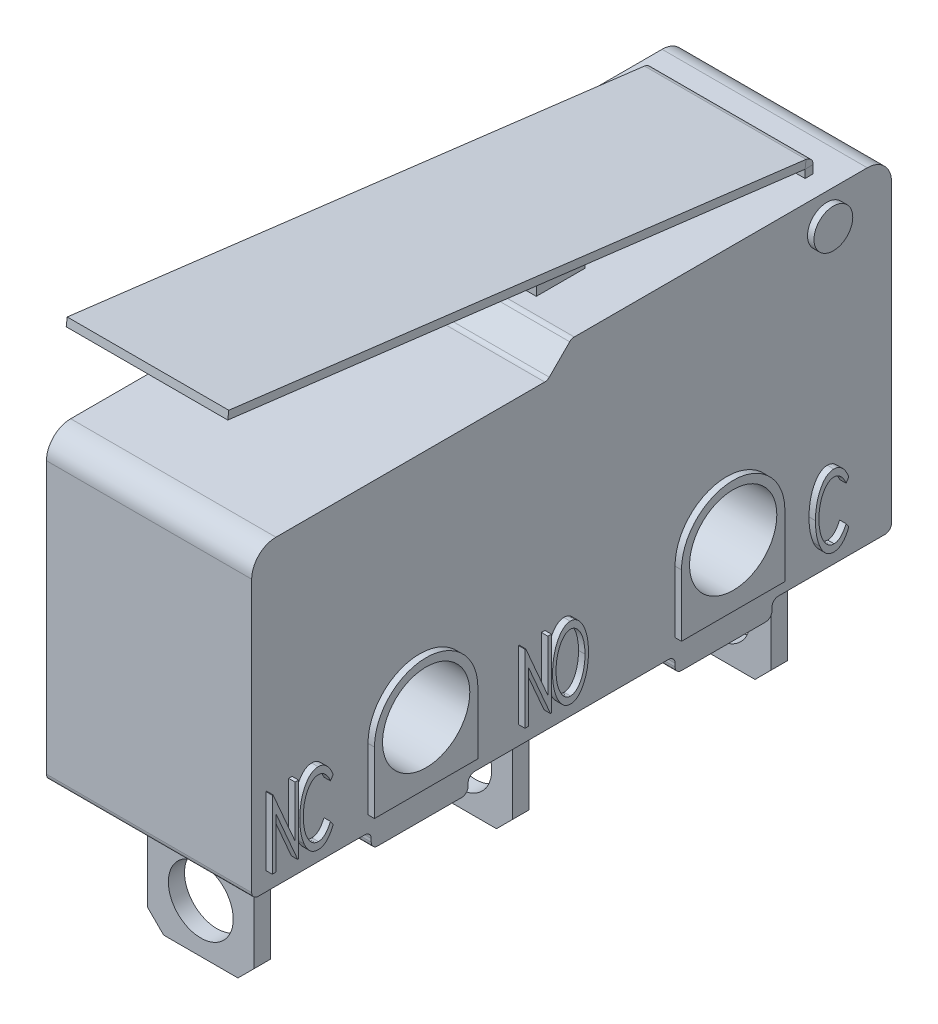
from build123d import *

# Parameters (mm, degrees)
BOSS_EXTRUDE1_DEPTH        = 3.175
SKETCH2_R                  = 1.35
CUT_EXTRUDE1_DEPTH         = 14.60340031
SKETCH4_W                  = 3
SKETCH4_H                  = 1.5
BOSS_EXTRUDE2_DEPTH        = 1
FILLET1_R                  = 0.25
SKETCH3_R                  = 0.6
BOSS_EXTRUDE3_DEPTH        = 0.2
BOSS_EXTRUDE4_START        = 0.2
SKETCH7_R                  = 1.35
BOSS_EXTRUDE4_DEPTH        = 0.2
BASE_FLANGE1_DEPTH         = 5
SKETCH13_W                 = 3.3
SKETCH13_H                 = 0.5
BOSS_EXTRUDE5_DEPTH        = 3.9
CHAMFER1_SIZE              = 0.5
SKETCH14_R                 = 1.003757991
CUT_EXTRUDE3_DEPTH         = 1
LPATTERN1_COUNT            = 3
LPATTERN1_PITCH            = 8
CHAMFER1_OF_LPATTERN1_SIZE = 0.5
BOSS_EXTRUDE6_DEPTH        = 0.2


# Sheet-metal steps are written as plain solids
with BuildPart() as part:
    # Sketch1 → Boss-Extrude1 (new, symmetric)
    with BuildSketch(Plane(origin=(0, 0, 0), x_dir=(0, 0, -1), z_dir=(1, 0, 0))):
        with BuildLine():
            Line((8.8, -4.8), (5.5, -4.8))
            ThreePointArc((5.5, -4.8), (5.358578644, -4.858578644), (5.3, -5))
            Line((5.3, -5), (5.3, -5.1))
            ThreePointArc((5.3, -5.1), (5.241421356, -5.241421356), (5.1, -5.3))
            Line((5.1, -5.3), (2.5, -5.3))
            ThreePointArc((2.5, -5.3), (2.358578644, -5.241421356), (2.3, -5.1))
            Line((2.3, -5.1), (2.3, -5))
            ThreePointArc((2.3, -5), (2.241421356, -4.858578644), (2.1, -4.8))
            Line((2.1, -4.8), (-3.9, -4.8))
            ThreePointArc((-3.9, -4.8), (-4.041421356, -4.858578644), (-4.1, -5))
            Line((-4.1, -5), (-4.1, -5.1))
            ThreePointArc((-4.1, -5.1), (-4.158578644, -5.241421356), (-4.3, -5.3))
            Line((-4.3, -5.3), (-6.9, -5.3))
            ThreePointArc((-6.9, -5.3), (-7.041421356, -5.241421356), (-7.1, -5.1))
            Line((-7.1, -5.1), (-7.1, -5))
            ThreePointArc((-7.1, -5), (-7.158578644, -4.858578644), (-7.3, -4.8))
            Line((-7.3, -4.8), (-10.6, -4.8))
            ThreePointArc((-10.6, -4.8), (-10.741421356, -4.741421356), (-10.8, -4.6))
            Line((-10.8, -4.6), (-10.8, 3.8))
            ThreePointArc((-10.8, 3.8), (-10.580330086, 4.330330086), (-10.05, 4.55))
            Line((-10.05, 4.55), (-1.732842712, 4.55))
            ThreePointArc((-1.732842712, 4.55), (-1.656306026, 4.565224093), (-1.591421356, 4.608578644))
            Line((-1.591421356, 4.608578644), (-0.958578644, 5.241421356))
            ThreePointArc((-0.958578644, 5.241421356), (-0.893693974, 5.284775907), (-0.817157288, 5.3))
            Line((-0.817157288, 5.3), (8.25, 5.3))
            ThreePointArc((8.25, 5.3), (8.780330086, 5.080330086), (9, 4.55))
            Line((9, 4.55), (9, -4.6))
            ThreePointArc((9, -4.6), (8.941421356, -4.741421356), (8.8, -4.8))
        make_face()
    extrude(amount=BOSS_EXTRUDE1_DEPTH, both=True)

    # Sketch2 → Cut-Extrude1 (cut, through all)
    with BuildSketch(Plane(origin=(3.175, 0, 0), x_dir=(0, 0, -1), z_dir=(1, 0, 0))):
        with Locations((-5.6, -2.4)):
            Circle(SKETCH2_R)
        with Locations((3.9, -2.4)):
            Circle(SKETCH2_R)
    extrude(amount=-CUT_EXTRUDE1_DEPTH, mode=Mode.SUBTRACT)

    # Sketch4 → Boss-Extrude2 (add)
    with BuildSketch(Plane(origin=(0, 5.3, 0), x_dir=(1, 0, 0), z_dir=(0, 1, 0))):
        with Locations((0, 0.432842712)):
            Rectangle(SKETCH4_W, SKETCH4_H)
    extrude(amount=BOSS_EXTRUDE2_DEPTH)

    # Fillet1
    fillet1_edges = [part.edges().sort_by_distance(p)[0] for p in [
        (1.5, 6.3, -0.432842712),
        (0, 6.3, -1.182842712),
        (-1.5, 6.3, -0.432842712),
        (0, 6.3, 0.317157288),
    ]]
    fillet(fillet1_edges, radius=FILLET1_R)

    # Sketch3 → Boss-Extrude3 (add)
    with BuildSketch(Plane(origin=(3.175, 0, 0), x_dir=(0, 0, -1), z_dir=(1, 0, 0))):
        with Locations((7, 4.4)):
            Circle(SKETCH3_R)
    boss_extrude3 = extrude(amount=BOSS_EXTRUDE3_DEPTH)

    # Mirror2: Boss-Extrude3 across plane
    add(boss_extrude3.mirror(Plane(origin=(0, 0, 0), x_dir=(0, 0, 1), z_dir=(1, 0, 0))))

    # Sketch7 → Boss-Extrude4 (add)
    # profile 1 of 2: a face of its own
    with BuildSketch(Plane(origin=(3.175, 0, 0), x_dir=(0, 0, -1), z_dir=(1, 0, 0)).offset(BOSS_EXTRUDE4_START)):
        with BuildLine():
            Line((-7.2, -2.4), (-7.2, -4.31448584))
            Line((-7.2, -4.31448584), (-4, -4.31448584))
            Line((-4, -4.31448584), (-4, -2.4))
            ThreePointArc((-4, -2.4), (-5.6, -0.8), (-7.2, -2.4))
        make_face()
        with Locations((-5.6, -2.4)):
            Circle(SKETCH7_R, mode=Mode.SUBTRACT)
    # profile 2 of 2: a face of its own
    with BuildSketch(Plane(origin=(3.175, 0, 0), x_dir=(0, 0, -1), z_dir=(1, 0, 0)).offset(BOSS_EXTRUDE4_START)):
        with BuildLine():
            Line((2.3, -4.31448584), (5.5, -4.31448584))
            Line((5.5, -4.31448584), (5.5, -2.4))
            ThreePointArc((5.5, -2.4), (3.9, -0.8), (2.3, -2.4))
            Line((2.3, -2.4), (2.3, -4.31448584))
        make_face()
        with Locations((3.9, -2.4)):
            Circle(SKETCH7_R, mode=Mode.SUBTRACT)
    extrude(amount=-BOSS_EXTRUDE4_DEPTH)

    # Sketch13 → Boss-Extrude5 (add)
    with BuildSketch(Plane.XZ.offset(4.8)):
        with Locations((0, 8.95)):
            Rectangle(SKETCH13_W, SKETCH13_H)
    boss_extrude5 = extrude(amount=BOSS_EXTRUDE5_DEPTH)

    # Chamfer1
    chamfer1_edges = [part.edges().sort_by_distance(p)[0] for p in [
        (1.65, -8.7, 8.95),
        (-1.65, -8.7, 8.95),
    ]]
    chamfer(chamfer1_edges, length=CHAMFER1_SIZE)

    # Sketch14 → Cut-Extrude3 (cut)
    with BuildSketch(Plane.XY.offset(9.2)):
        with Locations((0, -7.2)):
            Circle(SKETCH14_R)
    cut_extrude3 = extrude(amount=-CUT_EXTRUDE3_DEPTH, mode=Mode.SUBTRACT)

    # LPattern1: Boss-Extrude5, Cut-Extrude3 ×3
    with Locations(*[(0, 0, -i * LPATTERN1_PITCH) for i in range(1, LPATTERN1_COUNT)]):
        add(boss_extrude5)
        add(cut_extrude3, mode=Mode.SUBTRACT)

    # Chamfer1 of LPattern1
    chamfer1_of_lpattern1_edges = [part.edges().sort_by_distance(p)[0] for p in [
        (1.65, -8.7, 0.95),
        (-1.65, -8.7, 0.95),
        (1.65, -8.7, -7.05),
        (-1.65, -8.7, -7.05),
    ]]
    chamfer(chamfer1_of_lpattern1_edges, length=CHAMFER1_OF_LPATTERN1_SIZE)

    # Sketch15 → Boss-Extrude6 (add)
    # profile 1 of 5: a face of its own
    with BuildSketch(Plane(origin=(3.175, 0, 0), x_dir=(0, 0, -1), z_dir=(1, 0, 0))):
        Polygon((-10.362721569, -4.225379515), (-10.362721569, -2.108712848), (-10.339824934, -2.108712848), (-9.657166013, -3.689004648), (-9.657166013, -2.108712848), (-9.548619005, -2.108712848), (-9.548619005, -4.225379515), (-9.573211686, -4.225379515), (-10.25417456, -2.649327832), (-10.25417456, -4.225379515), align=None)
    # profile 2 of 5: a face of its own
    with BuildSketch(Plane(origin=(3.175, 0, 0), x_dir=(0, 0, -1), z_dir=(1, 0, 0))):
        with BuildLine():
            Line((-8.47943097, -2.497107613), (-8.562537274, -2.624311139))
            add(Edge.make_bspline(
                [(-8.562537274, -2.624311139), (-8.574244681, -2.596968081), (-8.596637943, -2.544667838), (-8.635807848, -2.472892292), (-8.679327841, -2.412007646), (-8.725978413, -2.361411429), (-8.77564296, -2.321279355), (-8.828316736, -2.292681316), (-8.883610295, -2.274541965), (-8.921682492, -2.272537533), (-8.940755757, -2.271533361)],
                knots=[0, 0, 0, 0, 1.299185471, 2.485007972, 3.564697683, 4.560911303, 5.483881321, 6.340461428, 7.168610648, 8, 8, 8, 8], degree=3))
            add(Edge.make_bspline(
                [(-8.940755757, -2.271533361), (-8.951246667, -2.271785448), (-8.972259958, -2.27229038), (-9.003218455, -2.278706612), (-9.033711522, -2.287974648), (-9.063555279, -2.301313425), (-9.092725087, -2.318365685), (-9.121544604, -2.338923678), (-9.149267418, -2.363606182), (-9.186161864, -2.401711145), (-9.229014876, -2.457140716), (-9.273393152, -2.533536413), (-9.312592953, -2.619657517), (-9.34460312, -2.715690595), (-9.370271937, -2.819782525), (-9.388797996, -2.930613502), (-9.399924472, -3.047812194), (-9.401349368, -3.128012225), (-9.402080543, -3.16916624)],
                knots=[0, 0, 0, 0, 0.45774643, 0.916866041, 1.375985651, 1.848859789, 2.34149154, 2.850576784, 3.393287444, 3.961145049, 5.167050785, 6.443546623, 7.814561503, 9.295151989, 10.860649304, 12.495527756, 14.201707638, 16, 16, 16, 16], degree=3))
            add(Edge.make_bspline(
                [(-9.402080543, -3.16916624), (-9.401705236, -3.20041451), (-9.400970792, -3.261564742), (-9.394293676, -3.351255123), (-9.384450045, -3.436931343), (-9.369932448, -3.518754422), (-9.35146688, -3.596693261), (-9.32853888, -3.670796259), (-9.301383003, -3.740740486), (-9.270819148, -3.806245799), (-9.236728696, -3.865638437), (-9.200625479, -3.918158077), (-9.161673161, -3.962345114), (-9.120916555, -3.998880297), (-9.077606785, -4.027584596), (-9.031762441, -4.047392193), (-8.983902197, -4.060706104), (-8.951021517, -4.061936738), (-8.93439558, -4.062559002)],
                knots=[0, 0, 0, 0, 1.361066875, 2.663493237, 3.915974716, 5.116529894, 6.281377342, 7.403118823, 8.492786024, 9.54768219, 10.548887674, 11.472965329, 12.319202403, 13.108680678, 13.851549293, 14.571113617, 15.277491369, 16, 16, 16, 16], degree=3))
            add(Edge.make_bspline(
                [(-8.93439558, -4.062559002), (-8.916174508, -4.061510785), (-8.879679054, -4.059411285), (-8.826485068, -4.041751184), (-8.775779458, -4.013712776), (-8.727892085, -3.974079183), (-8.682451756, -3.923747852), (-8.639292245, -3.862590633), (-8.598576945, -3.790428456), (-8.574950949, -3.73755974), (-8.562537274, -3.709781224)],
                knots=[0, 0, 0, 0, 0.803819289, 1.609990315, 2.451669169, 3.353266404, 4.343836988, 5.441246616, 6.655568437, 8, 8, 8, 8], degree=3))
            Line((-8.562537274, -3.709781224), (-8.47943097, -3.835712715))
            add(Edge.make_bspline(
                [(-8.47943097, -3.835712715), (-8.486067274, -3.852875849), (-8.499117018, -3.886625738), (-8.520769971, -3.93507598), (-8.543057186, -3.980901155), (-8.567595396, -4.023138971), (-8.592139933, -4.063283836), (-8.619149995, -4.099596759), (-8.646654344, -4.133346618), (-8.675421576, -4.163970527), (-8.705414432, -4.190963648), (-8.736196583, -4.214717244), (-8.768003638, -4.234457257), (-8.800409267, -4.251424725), (-8.834025021, -4.264148937), (-8.868607471, -4.272942639), (-8.903949298, -4.278813653), (-8.927870562, -4.279372039), (-8.939907733, -4.279653019)],
                knots=[0, 0, 0, 0, 1.296200491, 2.548871353, 3.737868192, 4.884022115, 5.989127934, 7.050667326, 8.069356663, 9.055503585, 10.007320038, 10.90950695, 11.790846336, 12.641442791, 13.482897822, 14.316123122, 15.152673735, 16, 16, 16, 16], degree=3))
            add(Edge.make_bspline(
                [(-8.939907733, -4.279653019), (-8.96249962, -4.278528799), (-9.007101277, -4.276309327), (-9.071895956, -4.257997376), (-9.132883667, -4.228808399), (-9.190048243, -4.187690661), (-9.242748503, -4.134535091), (-9.291964982, -4.070344229), (-9.337569121, -3.994587812), (-9.363206661, -3.938748573), (-9.376639838, -3.909490759)],
                knots=[0, 0, 0, 0, 0.889987636, 1.757043257, 2.634913996, 3.546251599, 4.520108944, 5.577402331, 6.730643314, 8, 8, 8, 8], degree=3))
            add(Edge.make_bspline(
                [(-9.376639838, -3.909490759), (-9.387465946, -3.882912213), (-9.409441811, -3.82896055), (-9.43598485, -3.744310556), (-9.459754899, -3.656027329), (-9.47788634, -3.563430016), (-9.493125631, -3.46702618), (-9.502773846, -3.366483493), (-9.509518878, -3.261975597), (-9.510253321, -3.190943716), (-9.510627552, -3.154749841)],
                knots=[0, 0, 0, 0, 0.892200441, 1.811073353, 2.756806339, 3.734396212, 4.744014794, 5.791127521, 6.874482058, 8, 8, 8, 8], degree=3))
            add(Edge.make_bspline(
                [(-9.510627552, -3.154749841), (-9.510158734, -3.116716976), (-9.50923929, -3.042126916), (-9.501447515, -2.932589778), (-9.488861475, -2.827704101), (-9.471183271, -2.727432289), (-9.448072863, -2.631811489), (-9.420986896, -2.540483333), (-9.387555592, -2.454053864), (-9.349912261, -2.372921507), (-9.308593128, -2.29882185), (-9.264185293, -2.233796957), (-9.216761734, -2.178929608), (-9.167205206, -2.133341415), (-9.11453992, -2.09785483), (-9.059032663, -2.072982117), (-9.000963406, -2.057375341), (-8.961204176, -2.05542275), (-8.941179768, -2.054439344)],
                knots=[0, 0, 0, 0, 1.350883623, 2.649353136, 3.89856053, 5.102044923, 6.263763384, 7.391449509, 8.483282176, 9.552439238, 10.566269587, 11.493781365, 12.344403006, 13.137041638, 13.879228367, 14.589340494, 15.289532994, 16, 16, 16, 16], degree=3))
            add(Edge.make_bspline(
                [(-8.941179768, -2.054439344), (-8.929003549, -2.054729933), (-8.904805689, -2.055307422), (-8.868976451, -2.061042262), (-8.834179116, -2.07034918), (-8.800367408, -2.083406125), (-8.767046392, -2.099204144), (-8.735301934, -2.120165835), (-8.703865307, -2.14365133), (-8.673740337, -2.17113166), (-8.64455247, -2.201461896), (-8.616933471, -2.235185215), (-8.590891709, -2.271851245), (-8.564933515, -2.310653306), (-8.542178044, -2.353427434), (-8.519338262, -2.398437789), (-8.49825179, -2.446570643), (-8.485770874, -2.480083938), (-8.47943097, -2.497107613)],
                knots=[0, 0, 0, 0, 0.856532349, 1.702190794, 2.54685376, 3.387581895, 4.250790716, 5.136691882, 6.059960502, 7.01095472, 8.003107282, 9.020916617, 10.075690141, 11.16844244, 12.303884376, 13.482947173, 14.721418249, 16, 16, 16, 16], degree=3))
        make_face()
    # profile 3 of 5: a face of its own
    with BuildSketch(Plane(origin=(3.175, 0, 0), x_dir=(0, 0, -1), z_dir=(1, 0, 0))):
        Polygon((-2.541909603, -4.225379515), (-2.541909603, -2.108712848), (-2.519012968, -2.108712848), (-1.836354047, -3.689004648), (-1.836354047, -2.108712848), (-1.727807039, -2.108712848), (-1.727807039, -4.225379515), (-1.75239972, -4.225379515), (-2.433362594, -2.649327832), (-2.433362594, -4.225379515), align=None)
    # profile 4 of 5: a face of its own
    with BuildSketch(Plane(origin=(3.175, 0, 0), x_dir=(0, 0, -1), z_dir=(1, 0, 0))):
        with BuildLine():
            add(Edge.make_bspline(
                [(-1.140296355, -2.054439344), (-1.12056036, -2.055430119), (-1.081506478, -2.05739068), (-1.02418043, -2.072848731), (-0.970058861, -2.0990642), (-0.917505606, -2.13398732), (-0.8688527, -2.180482277), (-0.821942899, -2.235956348), (-0.777994017, -2.301849054), (-0.737052788, -2.376759285), (-0.699940293, -2.458831074), (-0.666386723, -2.545992003), (-0.63939179, -2.638189329), (-0.616034285, -2.734728061), (-0.599179206, -2.836106558), (-0.586312789, -2.942050506), (-0.578626133, -3.05259039), (-0.577686762, -3.127883827), (-0.577208748, -3.166198158)],
                knots=[0, 0, 0, 0, 0.697703435, 1.380625952, 2.08304486, 2.818152511, 3.603683708, 4.455297441, 5.384594416, 6.400739172, 7.472671852, 8.569546054, 9.702367839, 10.869238334, 12.081900159, 13.336116435, 14.644438064, 16, 16, 16, 16], degree=3))
            add(Edge.make_bspline(
                [(-0.577208748, -3.166198158), (-0.57768471, -3.204230187), (-0.57861993, -3.278959614), (-0.586342703, -3.388788923), (-0.59915503, -3.494176609), (-0.616155432, -3.595380093), (-0.63928993, -3.691972956), (-0.666566353, -3.784501013), (-0.699839129, -3.872182302), (-0.737027435, -3.954796205), (-0.778058318, -4.029902843), (-0.821275143, -4.096332801), (-0.866785408, -4.152950786), (-0.915604993, -4.198590208), (-0.965819443, -4.23541481), (-1.019300916, -4.260491324), (-1.074750512, -4.276802278), (-1.112765593, -4.27870134), (-1.13181612, -4.279653019)],
                knots=[0, 0, 0, 0, 1.351899477, 2.656357689, 3.911492368, 5.124913317, 6.302167622, 7.440324297, 8.551761772, 9.633315432, 10.658649878, 11.590929775, 12.447851287, 13.233410879, 13.961168659, 14.651123101, 15.324036257, 16, 16, 16, 16], degree=3))
            add(Edge.make_bspline(
                [(-1.13181612, -4.279653019), (-1.151147063, -4.278708819), (-1.189577333, -4.276831731), (-1.245626778, -4.26054457), (-1.299389336, -4.235226526), (-1.350671912, -4.199395536), (-1.399191904, -4.153200677), (-1.445500864, -4.097222476), (-1.488867316, -4.030919793), (-1.530012453, -3.956085729), (-1.567079033, -3.873984342), (-1.600565326, -3.786948342), (-1.627588444, -3.695189043), (-1.650894326, -3.599636188), (-1.667867057, -3.499691717), (-1.680660671, -3.395716523), (-1.688409065, -3.28744196), (-1.689341117, -3.213841413), (-1.689815586, -3.17637444)],
                knots=[0, 0, 0, 0, 0.689462653, 1.370664406, 2.068692141, 2.805518958, 3.595074731, 4.455674158, 5.395482118, 6.421605811, 7.504065286, 8.61171122, 9.750821081, 10.919327309, 12.123993778, 13.370474487, 14.661418077, 16, 16, 16, 16], degree=3))
            add(Edge.make_bspline(
                [(-1.689815586, -3.17637444), (-1.688908847, -3.126451572), (-1.687122773, -3.028114552), (-1.673349992, -2.883457747), (-1.650710571, -2.744252693), (-1.623427814, -2.632807163), (-1.598307646, -2.547453818), (-1.576737981, -2.487695479), (-1.554715778, -2.431070408), (-1.529789149, -2.378543793), (-1.504095674, -2.329115774), (-1.476467478, -2.283249522), (-1.447363232, -2.240740153), (-1.416324923, -2.202177379), (-1.384521564, -2.167508316), (-1.351525473, -2.137517318), (-1.318125758, -2.111976755), (-1.283981746, -2.090900063), (-1.248996396, -2.074538333), (-1.21317675, -2.063282765), (-1.176959487, -2.055436166), (-1.152492005, -2.054770927), (-1.140296355, -2.054439344)],
                knots=[0, 0, 0, 0, 2.212834692, 4.358795431, 6.435399291, 8.459609044, 9.440832719, 10.378185893, 11.275241272, 12.132966736, 12.954144476, 13.743934771, 14.50517442, 15.236132671, 15.936649409, 16.58866456, 17.210224657, 17.798024575, 18.364291733, 18.917123282, 19.460247421, 20, 20, 20, 20], degree=3))
        make_face()
        with BuildLine():
            add(Edge.make_bspline(
                [(-1.135632226, -2.271533361), (-1.145419282, -2.271783622), (-1.165037344, -2.272285268), (-1.194008489, -2.278773562), (-1.22267122, -2.288012317), (-1.250950662, -2.301294116), (-1.278380723, -2.318955365), (-1.305737902, -2.339956101), (-1.332870159, -2.364456097), (-1.368356848, -2.403292509), (-1.410417522, -2.459157196), (-1.454353705, -2.536028665), (-1.492618352, -2.623312207), (-1.524026914, -2.720319706), (-1.550059269, -2.825245219), (-1.567785984, -2.936891696), (-1.579134762, -3.054307051), (-1.580546591, -3.134511265), (-1.581268577, -3.175526416)],
                knots=[0, 0, 0, 0, 0.429687379, 0.861304334, 1.299718125, 1.753041703, 2.230814808, 2.731922894, 3.268885931, 3.83639874, 5.043729528, 6.336130455, 7.72232143, 9.228252964, 10.816002597, 12.472761054, 14.196226436, 16, 16, 16, 16], degree=3))
            add(Edge.make_bspline(
                [(-1.581268577, -3.175526416), (-1.580839281, -3.20606456), (-1.579997748, -3.265927425), (-1.574056305, -3.353823284), (-1.563982139, -3.438060429), (-1.549460208, -3.518705844), (-1.531454031, -3.595962619), (-1.509017481, -3.669521926), (-1.48210701, -3.739249278), (-1.452069803, -3.804832635), (-1.419004595, -3.864593169), (-1.383890001, -3.917121461), (-1.347016194, -3.961727916), (-1.308127849, -3.998201768), (-1.267873484, -4.027215419), (-1.225357551, -4.047452465), (-1.18122139, -4.060609627), (-1.150846238, -4.061908457), (-1.135632226, -4.062559002)],
                knots=[0, 0, 0, 0, 1.360052788, 2.666064423, 3.92156836, 5.136589411, 6.313794507, 7.452763135, 8.558670704, 9.640213892, 10.663103522, 11.597163197, 12.450690674, 13.234545398, 13.96632053, 14.65049331, 15.324072146, 16, 16, 16, 16], degree=3))
            add(Edge.make_bspline(
                [(-1.135632226, -4.062559002), (-1.125429747, -4.062272063), (-1.105154122, -4.061701823), (-1.075099209, -4.055877658), (-1.045623222, -4.046518615), (-1.016746882, -4.033137033), (-0.988309993, -4.016597408), (-0.96035436, -3.996421726), (-0.933482012, -3.972168848), (-0.907117453, -3.944525707), (-0.881957645, -3.913626402), (-0.857551837, -3.880138875), (-0.835315328, -3.84347512), (-0.81399237, -3.804535469), (-0.79449943, -3.762683939), (-0.776402263, -3.718201207), (-0.759254582, -3.671050449), (-0.73902475, -3.60365488), (-0.717034672, -3.515051015), (-0.699229753, -3.403564798), (-0.687891168, -3.286569804), (-0.686478318, -3.206647875), (-0.685755757, -3.165774146)],
                knots=[0, 0, 0, 0, 0.56080804, 1.114506996, 1.677736382, 2.258934431, 2.861840694, 3.485651779, 4.152164525, 4.850754609, 5.585630451, 6.343240394, 7.128872211, 7.943195908, 8.785126645, 9.667534391, 10.585122498, 11.544567059, 13.538304409, 15.603140373, 17.751355024, 20, 20, 20, 20], degree=3))
            add(Edge.make_bspline(
                [(-0.685755757, -3.165774146), (-0.686483261, -3.125183797), (-0.687905571, -3.045827464), (-0.69914377, -2.929943526), (-0.717093106, -2.819890295), (-0.742871175, -2.71658659), (-0.774618971, -2.620975434), (-0.812554628, -2.534584809), (-0.857208788, -2.458663012), (-0.899441699, -2.4030433), (-0.93544842, -2.364620626), (-0.962604917, -2.339651527), (-0.990744143, -2.319096139), (-1.018608905, -2.301260426), (-1.047333666, -2.288012526), (-1.076412466, -2.278769731), (-1.105807486, -2.272285192), (-1.125704417, -2.271783624), (-1.135632226, -2.271533361)],
                knots=[0, 0, 0, 0, 1.79482937, 3.508988734, 5.143911176, 6.722083077, 8.212475766, 9.594768512, 10.886545486, 12.099243441, 12.674102895, 13.21398291, 13.727795565, 14.213462376, 14.674913904, 15.121652301, 15.561738042, 16, 16, 16, 16], degree=3))
        make_face(mode=Mode.SUBTRACT)
    # profile 5 of 5: a face of its own
    with BuildSketch(Plane(origin=(3.175, 0, 0), x_dir=(0, 0, -1), z_dir=(1, 0, 0))):
        with BuildLine():
            Line((7.476979286, -2.497107613), (7.393872983, -2.624311139))
            add(Edge.make_bspline(
                [(7.393872983, -2.624311139), (7.382165575, -2.596968081), (7.359772313, -2.544667838), (7.320602409, -2.472892292), (7.277082415, -2.412007646), (7.230431843, -2.361411429), (7.180767297, -2.321279355), (7.12809352, -2.292681316), (7.072799961, -2.274541965), (7.034727765, -2.272537533), (7.0156545, -2.271533361)],
                knots=[0, 0, 0, 0, 1.299185471, 2.485007972, 3.564697683, 4.560911303, 5.483881321, 6.340461428, 7.168610648, 8, 8, 8, 8], degree=3))
            add(Edge.make_bspline(
                [(7.0156545, -2.271533361), (7.00516359, -2.271785448), (6.984150299, -2.27229038), (6.953191802, -2.278706612), (6.922698735, -2.287974648), (6.892854978, -2.301313425), (6.863685169, -2.318365685), (6.834865653, -2.338923678), (6.807142838, -2.363606182), (6.770248392, -2.401711145), (6.727395381, -2.457140716), (6.683017104, -2.533536413), (6.643817304, -2.619657517), (6.611807137, -2.715690595), (6.586138319, -2.819782525), (6.56761226, -2.930613502), (6.556485785, -3.047812194), (6.555060888, -3.128012225), (6.554329713, -3.16916624)],
                knots=[0, 0, 0, 0, 0.45774643, 0.916866041, 1.375985651, 1.848859789, 2.34149154, 2.850576784, 3.393287444, 3.961145049, 5.167050785, 6.443546623, 7.814561503, 9.295151989, 10.860649304, 12.495527756, 14.201707638, 16, 16, 16, 16], degree=3))
            add(Edge.make_bspline(
                [(6.554329713, -3.16916624), (6.55470502, -3.20041451), (6.555439465, -3.261564742), (6.56211658, -3.351255123), (6.571960212, -3.436931343), (6.586477809, -3.518754422), (6.604943377, -3.596693261), (6.627871377, -3.670796259), (6.655027254, -3.740740486), (6.685591109, -3.806245799), (6.719681561, -3.865638437), (6.755784777, -3.918158077), (6.794737095, -3.962345114), (6.835493701, -3.998880297), (6.878803471, -4.027584596), (6.924647815, -4.047392193), (6.972508059, -4.060706104), (7.005388739, -4.061936738), (7.022014676, -4.062559002)],
                knots=[0, 0, 0, 0, 1.361066875, 2.663493237, 3.915974716, 5.116529894, 6.281377342, 7.403118823, 8.492786024, 9.54768219, 10.548887674, 11.472965329, 12.319202403, 13.108680678, 13.851549293, 14.571113617, 15.277491369, 16, 16, 16, 16], degree=3))
            add(Edge.make_bspline(
                [(7.022014676, -4.062559002), (7.040235748, -4.061510785), (7.076731203, -4.059411285), (7.129925188, -4.041751184), (7.180630798, -4.013712776), (7.228518171, -3.974079183), (7.2739585, -3.923747852), (7.317118011, -3.862590633), (7.357833311, -3.790428456), (7.381459307, -3.73755974), (7.393872983, -3.709781224)],
                knots=[0, 0, 0, 0, 0.803819289, 1.609990315, 2.451669169, 3.353266404, 4.343836988, 5.441246616, 6.655568437, 8, 8, 8, 8], degree=3))
            Line((7.393872983, -3.709781224), (7.476979286, -3.835712715))
            add(Edge.make_bspline(
                [(7.476979286, -3.835712715), (7.470342982, -3.852875849), (7.457293238, -3.886625738), (7.435640285, -3.93507598), (7.41335307, -3.980901155), (7.38881486, -4.023138971), (7.364270324, -4.063283836), (7.337260262, -4.099596759), (7.309755913, -4.133346618), (7.280988681, -4.163970527), (7.250995824, -4.190963648), (7.220213674, -4.214717244), (7.188406618, -4.234457257), (7.15600099, -4.251424725), (7.122385235, -4.264148937), (7.087802785, -4.272942639), (7.052460958, -4.278813653), (7.028539695, -4.279372039), (7.016502523, -4.279653019)],
                knots=[0, 0, 0, 0, 1.296200491, 2.548871353, 3.737868192, 4.884022115, 5.989127934, 7.050667326, 8.069356663, 9.055503585, 10.007320038, 10.90950695, 11.790846336, 12.641442791, 13.482897822, 14.316123122, 15.152673735, 16, 16, 16, 16], degree=3))
            add(Edge.make_bspline(
                [(7.016502523, -4.279653019), (6.993910636, -4.278528799), (6.949308979, -4.276309327), (6.8845143, -4.257997376), (6.82352659, -4.228808399), (6.766362014, -4.187690661), (6.713661754, -4.134535091), (6.664445274, -4.070344229), (6.618841135, -3.994587812), (6.593203595, -3.938748573), (6.579770419, -3.909490759)],
                knots=[0, 0, 0, 0, 0.889987636, 1.757043257, 2.634913996, 3.546251599, 4.520108944, 5.577402331, 6.730643314, 8, 8, 8, 8], degree=3))
            add(Edge.make_bspline(
                [(6.579770419, -3.909490759), (6.56894431, -3.882912213), (6.546968446, -3.82896055), (6.520425407, -3.744310556), (6.496655357, -3.656027329), (6.478523916, -3.563430016), (6.463284625, -3.46702618), (6.45363641, -3.366483493), (6.446891379, -3.261975597), (6.446156936, -3.190943716), (6.445782705, -3.154749841)],
                knots=[0, 0, 0, 0, 0.892200441, 1.811073353, 2.756806339, 3.734396212, 4.744014794, 5.791127521, 6.874482058, 8, 8, 8, 8], degree=3))
            add(Edge.make_bspline(
                [(6.445782705, -3.154749841), (6.446251522, -3.116716976), (6.447170967, -3.042126916), (6.454962742, -2.932589778), (6.467548782, -2.827704101), (6.485226986, -2.727432289), (6.508337393, -2.631811489), (6.535423361, -2.540483333), (6.568854664, -2.454053864), (6.606497995, -2.372921507), (6.647817128, -2.29882185), (6.692224963, -2.233796957), (6.739648523, -2.178929608), (6.78920505, -2.133341415), (6.841870336, -2.09785483), (6.897377593, -2.072982117), (6.95544685, -2.057375341), (6.99520608, -2.05542275), (7.015230488, -2.054439344)],
                knots=[0, 0, 0, 0, 1.350883623, 2.649353136, 3.89856053, 5.102044923, 6.263763384, 7.391449509, 8.483282176, 9.552439238, 10.566269587, 11.493781365, 12.344403006, 13.137041638, 13.879228367, 14.589340494, 15.289532994, 16, 16, 16, 16], degree=3))
            add(Edge.make_bspline(
                [(7.015230488, -2.054439344), (7.027406708, -2.054729933), (7.051604567, -2.055307422), (7.087433805, -2.061042262), (7.122231141, -2.07034918), (7.156042848, -2.083406125), (7.189363865, -2.099204144), (7.221108323, -2.120165835), (7.25254495, -2.14365133), (7.28266992, -2.17113166), (7.311857787, -2.201461896), (7.339476785, -2.235185215), (7.365518547, -2.271851245), (7.391476741, -2.310653306), (7.414232213, -2.353427434), (7.437071994, -2.398437789), (7.458158467, -2.446570643), (7.470639383, -2.480083938), (7.476979286, -2.497107613)],
                knots=[0, 0, 0, 0, 0.856532349, 1.702190794, 2.54685376, 3.387581895, 4.250790716, 5.136691882, 6.059960502, 7.01095472, 8.003107282, 9.020916617, 10.075690141, 11.16844244, 12.303884376, 13.482947173, 14.721418249, 16, 16, 16, 16], degree=3))
        make_face()
    extrude(amount=BOSS_EXTRUDE6_DEPTH)


with BuildPart() as body_2:
    # Sketch8 → Base-Flange1 (new body)
    with BuildSketch(Plane(origin=(2.5, 0, 0), x_dir=(0, 0, -1), z_dir=(1, 0, 0))):
        with BuildLine():
            Line((7, 5.3), (7, 5.549116005))
            ThreePointArc((7, 5.549116005), (6.999749227, 5.549778318), (6.999122683, 5.550108451))
            Line((6.999122683, 5.550108451), (-10.864027304, 7.758286326))
            Line((-10.864027304, 7.758286326), (-10.83335666, 8.006397817))
            Line((-10.83335666, 8.006397817), (7.029793326, 5.798219941))
            ThreePointArc((7.029793326, 5.798219941), (7.187056009, 5.715356606), (7.25, 5.549116005))
            Line((7.25, 5.549116005), (7.25, 5.3))
            Line((7.25, 5.3), (7, 5.3))
        make_face()
    extrude(amount=-BASE_FLANGE1_DEPTH)


solid = Compound([part.part, body_2.part])
